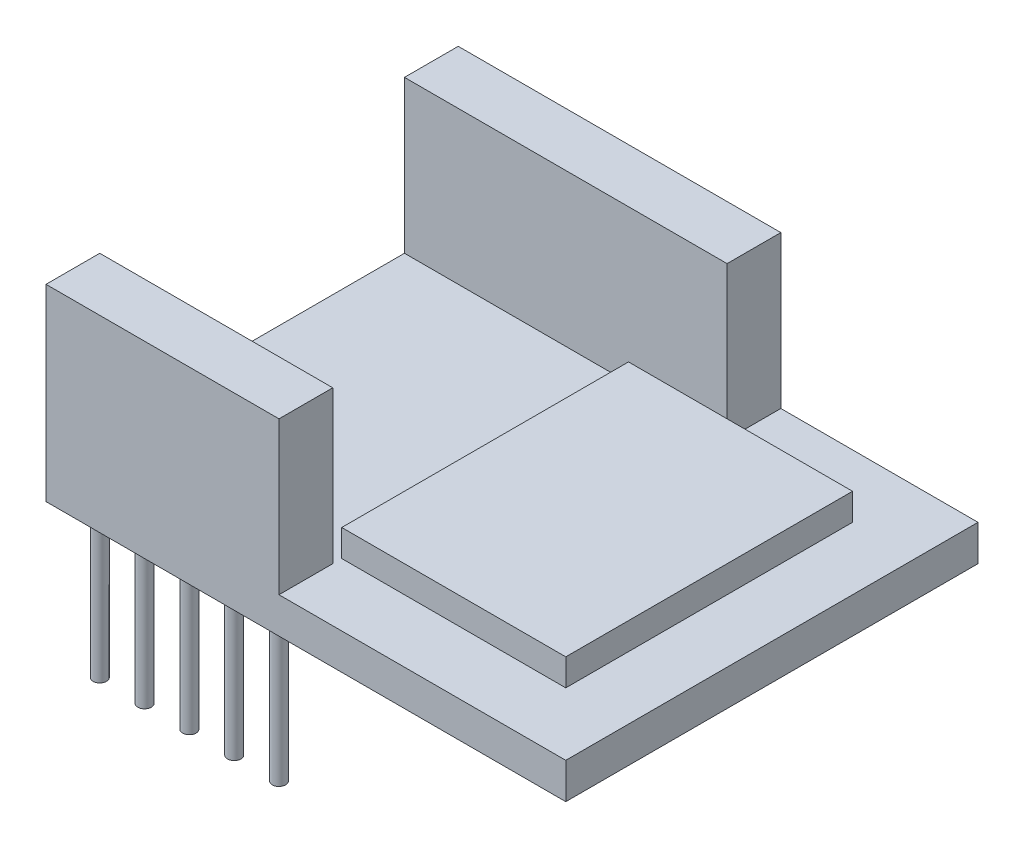
from build123d import *

# Parameters (mm, degrees)
SKETCH1_W           = 29
SKETCH1_H           = 23
BOSS_EXTRUDE1_DEPTH = 2
SKETCH2_W           = 13
SKETCH2_H           = 3
SKETCH2_W_2         = 18
BOSS_EXTRUDE2_DEPTH = 8.5
SKETCH3_R           = 0.375
BOSS_EXTRUDE3_DEPTH = 8.5
SKETCH5_W           = 12.5
SKETCH5_H           = 16
BOSS_EXTRUDE4_DEPTH = 1.5


with BuildPart() as part:
    # Sketch1 → Boss-Extrude1 (new body)
    with BuildSketch(Plane(origin=(0, 0, 0), x_dir=(1, 0, 0), z_dir=(0, 1, 0))):
        Rectangle(SKETCH1_W, SKETCH1_H)
    extrude(amount=BOSS_EXTRUDE1_DEPTH)

    # Sketch2 → Boss-Extrude2 (add)
    with BuildSketch(Plane(origin=(0, 2, 0), x_dir=(1, 0, 0), z_dir=(0, 1, 0))):
        with Locations((-8, -10)):
            Rectangle(SKETCH2_W, SKETCH2_H)
        with Locations((-5.5, 10)):
            Rectangle(SKETCH2_W_2, SKETCH2_H)
    extrude(amount=BOSS_EXTRUDE2_DEPTH)

    # Sketch3 → Boss-Extrude3 (add)
    with BuildSketch(Plane.XZ):
        with Locations((2, -10)):
            Circle(SKETCH3_R)
        with Locations((-0.5, -10)):
            Circle(SKETCH3_R)
        with Locations((-3, -10)):
            Circle(SKETCH3_R)
        with Locations((-5.5, -10)):
            Circle(SKETCH3_R)
        with Locations((-8, -10)):
            Circle(SKETCH3_R)
        with Locations((-3, 10)):
            Circle(SKETCH3_R)
        with Locations((-5.5, 10)):
            Circle(SKETCH3_R)
        with Locations((-8, 10)):
            Circle(SKETCH3_R)
        with Locations((-10.5, 10)):
            Circle(SKETCH3_R)
        with Locations((-13, 10)):
            Circle(SKETCH3_R)
        with Locations((-10.5, -10)):
            Circle(SKETCH3_R)
        with Locations((-13, -10)):
            Circle(SKETCH3_R)
    extrude(amount=BOSS_EXTRUDE3_DEPTH)

    # Sketch5 → Boss-Extrude4 (add)
    with BuildSketch(Plane(origin=(0, 2, 0), x_dir=(1, 0, 0), z_dir=(0, 1, 0))):
        with Locations((4.75, 0)):
            Rectangle(SKETCH5_W, SKETCH5_H)
    extrude(amount=BOSS_EXTRUDE4_DEPTH)


solid = part.part
